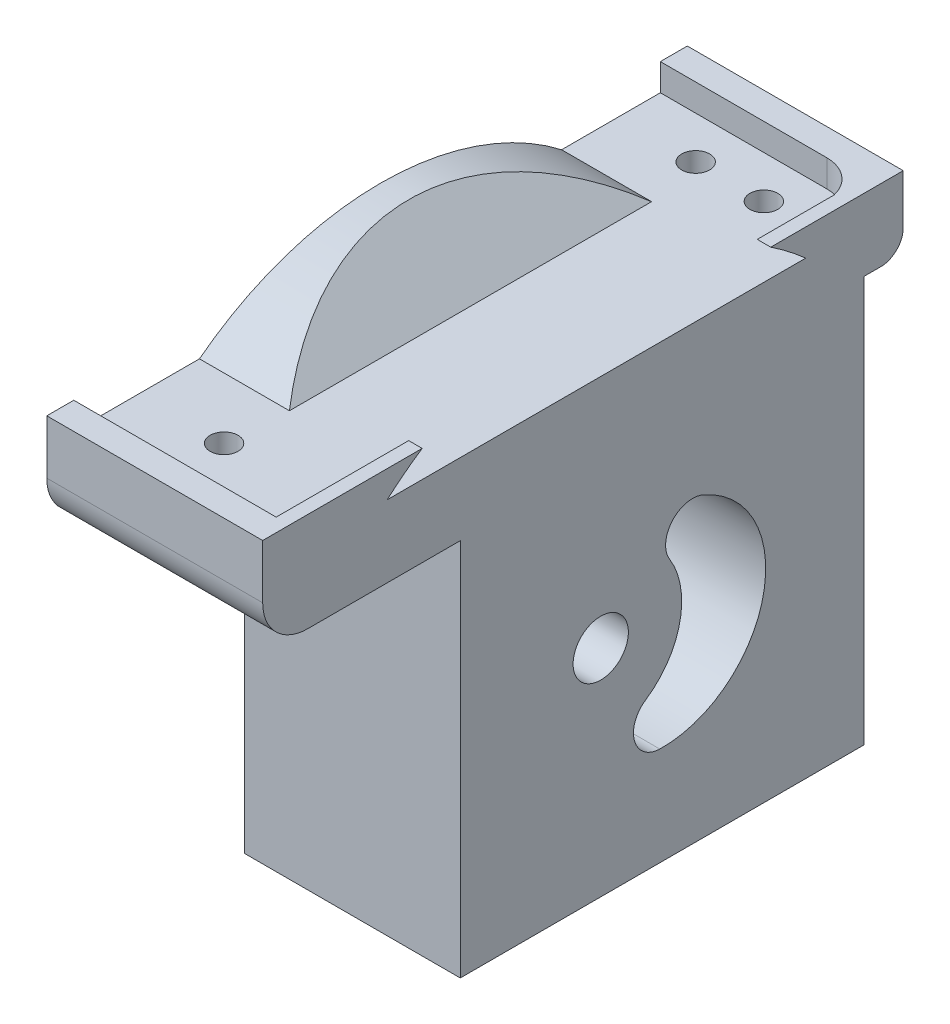
from build123d import *

# Parameters (mm, degrees)
SKETCH1_R           = 3.075
BOSS_EXTRUDE1_DEPTH = 5.5
BOSS_EXTRUDE2_START = -6
SKETCH1_3_R         = 6.11
BOSS_EXTRUDE2_DEPTH = 6
BOSS_EXTRUDE3_START = -17
SKETCH1_4_R         = 18.45
BOSS_EXTRUDE3_DEPTH = 11
BOSS_EXTRUDE4_DEPTH = 10
DRAFT1_ANGLE        = 45
BOSS_EXTRUDE5_DEPTH = 3
SKETCH4_R           = 3.075
BOSS_EXTRUDE6_DEPTH = 1.5
SKETCH3_3_R         = 1.55
CUT_EXTRUDE1_DEPTH  = 11
CUT_EXTRUDE2_START  = -7
SKETCH3_4_R         = 1.55
CUT_EXTRUDE2_DEPTH  = 2.6
CUT_EXTRUDE4_START  = -5.5
SKETCH3_5_R         = 1.55
CUT_EXTRUDE4_DEPTH  = 2.5
CUT_EXTRUDE5_START  = -13
CUT_EXTRUDE5_DEPTH  = 13
FILLET1_R           = 3


with BuildPart() as part:
    # Sketch1 → Boss-Extrude1 (new body)
    with BuildSketch(Plane(origin=(57.798756402, 0, 0), x_dir=(0, 0, -1), z_dir=(1, 0, 0))):
        with BuildLine():
            Line((33.998459558, 75.890266162), (78.898459558, 75.890266162))
            Line((78.898459558, 75.890266162), (78.898459558, 120.990266162))
            Line((78.898459558, 120.990266162), (80.735339486, 120.990266162))
            ThreePointArc((80.735339486, 120.990266162), (82.503106439, 121.722499209), (83.235339486, 123.490266162))
            Line((83.235339486, 123.490266162), (83.235339486, 128.990266162))
            Line((83.235339486, 128.990266162), (80.235339486, 128.990266162))
            Line((80.235339486, 128.990266162), (80.235339486, 125.990266162))
            Line((80.235339486, 125.990266162), (15.035339486, 125.990266162))
            Line((15.035339486, 125.990266162), (15.035339486, 128.990266162))
            Line((15.035339486, 128.990266162), (12.035339486, 128.990266162))
            Line((12.035339486, 128.990266162), (12.035339486, 122.990266162))
            ThreePointArc((12.035339486, 122.990266162), (13.49980558, 119.454732256), (17.035339486, 117.990266162))
            Line((17.035339486, 117.990266162), (33.998459558, 117.990266162))
            Line((33.998459558, 117.990266162), (33.998459558, 75.890266162))
        make_face()
        with Locations((49.610967501, 99.839833556)):
            Circle(SKETCH1_R, mode=Mode.SUBTRACT)
    extrude(amount=BOSS_EXTRUDE1_DEPTH)

    # Sketch1<3> → Boss-Extrude2 (add)
    with BuildSketch(Plane(origin=(57.798756402, 0, 0), x_dir=(0, 0, -1), z_dir=(1, 0, 0)).offset(BOSS_EXTRUDE2_START)):
        with BuildLine():
            Line((33.998459558, 75.890266162), (78.898459558, 75.890266162))
            Line((78.898459558, 75.890266162), (78.898459558, 120.990266162))
            Line((78.898459558, 120.990266162), (80.735339486, 120.990266162))
            ThreePointArc((80.735339486, 120.990266162), (82.503106439, 121.722499209), (83.235339486, 123.490266162))
            Line((83.235339486, 123.490266162), (83.235339486, 128.990266162))
            Line((83.235339486, 128.990266162), (80.235339486, 128.990266162))
            Line((80.235339486, 128.990266162), (80.235339486, 125.990266162))
            Line((80.235339486, 125.990266162), (15.035339486, 125.990266162))
            Line((15.035339486, 125.990266162), (15.035339486, 128.990266162))
            Line((15.035339486, 128.990266162), (12.035339486, 128.990266162))
            Line((12.035339486, 128.990266162), (12.035339486, 122.990266162))
            ThreePointArc((12.035339486, 122.990266162), (13.49980558, 119.454732256), (17.035339486, 117.990266162))
            Line((17.035339486, 117.990266162), (33.998459558, 117.990266162))
            Line((33.998459558, 117.990266162), (33.998459558, 75.890266162))
        make_face()
        with Locations(Location((49.610967501, 99.839833556, 0), (0, 0, 90))):
            Circle(SKETCH1_3_R, mode=Mode.SUBTRACT)
    extrude(amount=BOSS_EXTRUDE2_DEPTH)

    # Sketch1<4> → Boss-Extrude3 (add)
    with BuildSketch(Plane(origin=(57.798756402, 0, 0), x_dir=(0, 0, -1), z_dir=(1, 0, 0)).offset(BOSS_EXTRUDE3_START)):
        with BuildLine():
            Line((33.998459558, 75.890266162), (78.898459558, 75.890266162))
            Line((78.898459558, 75.890266162), (78.898459558, 120.990266162))
            Line((78.898459558, 120.990266162), (80.735339486, 120.990266162))
            ThreePointArc((80.735339486, 120.990266162), (82.503106439, 121.722499209), (83.235339486, 123.490266162))
            Line((83.235339486, 123.490266162), (83.235339486, 128.990266162))
            Line((83.235339486, 128.990266162), (80.235339486, 128.990266162))
            Line((80.235339486, 128.990266162), (80.235339486, 125.990266162))
            Line((80.235339486, 125.990266162), (15.035339486, 125.990266162))
            Line((15.035339486, 125.990266162), (15.035339486, 128.990266162))
            Line((15.035339486, 128.990266162), (12.035339486, 128.990266162))
            Line((12.035339486, 128.990266162), (12.035339486, 122.990266162))
            ThreePointArc((12.035339486, 122.990266162), (13.49980558, 119.454732256), (17.035339486, 117.990266162))
            Line((17.035339486, 117.990266162), (33.998459558, 117.990266162))
            Line((33.998459558, 117.990266162), (33.998459558, 75.890266162))
        make_face()
        with Locations(Location((56.448459558, 98.340266162, 0), (0, 0, 90))):
            Circle(SKETCH1_4_R, mode=Mode.SUBTRACT)
    extrude(amount=BOSS_EXTRUDE3_DEPTH)

    # Sketch2 → Boss-Extrude4 (add)
    with BuildSketch(Plane(origin=(40.798756402, 0, 0), x_dir=(0, 0, -1), z_dir=(1, 0, 0))):
        with BuildLine():
            ThreePointArc((69.263798804, 125.990266162), (49.135339486, 132.839833556), (29.006880169, 125.990266162))
            Line((29.006880169, 125.990266162), (69.263798804, 125.990266162))
        make_face()
    extrude(amount=BOSS_EXTRUDE4_DEPTH)

    # Draft1
    draft1_faces = [part.faces().sort_by_distance(p)[0] for p in [
        (50.798756402, 128.756028079, -49.135339486),
    ]]
    draft(draft1_faces, Plane(origin=(152.119080652, 125.990266162, 0), x_dir=(1, 0, 0), z_dir=(0, 1, 0)), DRAFT1_ANGLE)

    # Sketch3 → Boss-Extrude5 (add)
    with BuildSketch(Plane(origin=(0, 125.990266162, 0), x_dir=(1, 0, 0), z_dir=(0, 1, 0))):
        with BuildLine():
            Line((63.298756402, 80.235339486), (59.298756401, 80.235339486))
            ThreePointArc((59.298756401, 80.235339486), (61.860006097, 79.336901605), (63.298756402, 77.035339486))
            Line((63.298756402, 77.035339486), (63.298756402, 80.235339486))
        make_face()
    extrude(amount=BOSS_EXTRUDE5_DEPTH)

    # Sketch4 → Boss-Extrude6 (add)
    with BuildSketch(Plane(origin=(63.298756402, 0, 0), x_dir=(0, 0, -1), z_dir=(1, 0, 0))):
        with BuildLine():
            Line((29.763910038, 128.990266162), (12.035339486, 128.990266162))
            Line((12.035339486, 128.990266162), (12.035339486, 122.990266162))
            ThreePointArc((12.035339486, 122.990266162), (13.49980558, 119.454732256), (17.035339486, 117.990266162))
            Line((17.035339486, 117.990266162), (33.998459558, 117.990266162))
            Line((33.998459558, 117.990266162), (33.998459558, 75.890266162))
            Line((33.998459558, 75.890266162), (78.898459558, 75.890266162))
            Line((78.898459558, 75.890266162), (78.898459558, 120.990266162))
            Line((78.898459558, 120.990266162), (80.735339486, 120.990266162))
            ThreePointArc((80.735339486, 120.990266162), (82.503106439, 121.722499209), (83.235339486, 123.490266162))
            Line((83.235339486, 123.490266162), (83.235339486, 128.990266162))
            Line((83.235339486, 128.990266162), (68.506768934, 128.990266162))
            ThreePointArc((68.506768934, 128.990266162), (70.505131495, 127.558635649), (72.398075234, 125.990266162))
            Line((72.398075234, 125.990266162), (25.872603738, 125.990266162))
            ThreePointArc((25.872603738, 125.990266162), (27.765547478, 127.558635649), (29.763910038, 128.990266162))
        make_face()
        with Locations((49.610967501, 99.839833556)):
            Circle(SKETCH4_R, mode=Mode.SUBTRACT)
    extrude(amount=BOSS_EXTRUDE6_DEPTH)

    # Sketch3<3> → Cut-Extrude1 (cut)
    with BuildSketch(Plane(origin=(0, 125.990266162, 0), x_dir=(1, 0, 0), z_dir=(0, 1, 0))):
        with Locations(Location((49.426066799, 75.535339486, 0), (0, 0, 270))):
            Circle(SKETCH3_3_R)
        with Locations(Location((57.007859867, 75.535339486, 0), (0, 0, 270))):
            Circle(SKETCH3_3_R)
        with Locations(Location((50.298756402, 22.24178562, 0), (0, 0, 180))):
            Circle(SKETCH3_3_R)
    extrude(amount=-CUT_EXTRUDE1_DEPTH, mode=Mode.SUBTRACT)

    # Sketch3<4> → Cut-Extrude2 (cut)
    # profile 1 of 4: a face of its own
    with BuildSketch(Plane(origin=(0, 125.990266162, 0), x_dir=(1, 0, 0), z_dir=(0, 1, 0)).offset(CUT_EXTRUDE2_START)):
        Polygon((54.157859867, 77.180787753), (54.157859867, 73.889891219), (57.007859867, 72.244442952), (59.857859867, 73.889891219), (59.857859867, 77.180787753), (57.007859867, 78.826236021), align=None)
        with Locations(Location((57.007859867, 75.535339486, 0), (0, 0, 270))):
            Circle(SKETCH3_4_R, mode=Mode.SUBTRACT)
    # profile 2 of 4: a face of its own
    with BuildSketch(Plane(origin=(0, 125.990266162, 0), x_dir=(1, 0, 0), z_dir=(0, 1, 0)).offset(CUT_EXTRUDE2_START)):
        Polygon((46.576066799, 77.180787753), (46.576066799, 73.889891219), (49.426066799, 72.244442952), (52.276066799, 73.889891219), (52.276066799, 77.180787753), (49.426066799, 78.826236021), align=None)
        with Locations(Location((49.426066799, 75.535339486, 0), (0, 0, 270))):
            Circle(SKETCH3_4_R, mode=Mode.SUBTRACT)
    # profile 3 of 4: a face of its own
    with BuildSketch(Plane(origin=(0, 125.990266162, 0), x_dir=(1, 0, 0), z_dir=(0, 1, 0)).offset(CUT_EXTRUDE2_START)):
        Polygon((59.857859867, 78.898459558), (59.857859867, 77.180787753), (57.007859867, 78.826236021), (54.157859867, 77.180787753), (54.157859867, 78.898459558), align=None)
    # profile 4 of 4: a face of its own
    with BuildSketch(Plane(origin=(0, 125.990266162, 0), x_dir=(1, 0, 0), z_dir=(0, 1, 0)).offset(CUT_EXTRUDE2_START)):
        Polygon((52.276066799, 78.898459558), (52.276066799, 77.180787753), (49.426066799, 78.826236021), (46.576066799, 77.180787753), (46.576066799, 78.898459558), align=None)
    extrude(amount=-CUT_EXTRUDE2_DEPTH, mode=Mode.SUBTRACT)

    # Sketch3<5> → Cut-Extrude4 (cut)
    with BuildSketch(Plane(origin=(0, 125.990266162, 0), x_dir=(1, 0, 0), z_dir=(0, 1, 0)).offset(CUT_EXTRUDE4_START)):
        Polygon((48.653308134, 19.39178562), (51.944204669, 19.39178562), (53.589652936, 22.24178562), (51.944204669, 25.09178562), (48.653308134, 25.09178562), (47.007859867, 22.24178562), align=None)
        with Locations(Location((50.298756402, 22.24178562, 0), (0, 0, 180))):
            Circle(SKETCH3_5_R, mode=Mode.SUBTRACT)
    extrude(amount=-CUT_EXTRUDE4_DEPTH, mode=Mode.SUBTRACT)

    # Sketch6 → Cut-Extrude5 (cut)
    with BuildSketch(Plane.ZY.offset(-51.798756402).offset(CUT_EXTRUDE5_START)):
        with BuildLine():
            ThreePointArc((-47.52627647, 91.08460293), (-58.402028717, 97.911818335), (-51.38169206, 108.663921867))
            ThreePointArc((-51.38169206, 108.663921867), (-67.681482224, 95.876691159), (-47.52627647, 91.08460293))
        make_face()
    extrude(amount=CUT_EXTRUDE5_DEPTH, mode=Mode.SUBTRACT)

    # Fillet1
    fillet1_edges = [part.edges().sort_by_distance(p)[0] for p in [
        (58.298756402, 91.08460293, -47.52627647),
        (58.298756402, 108.663921867, -51.38169206),
    ]]
    fillet(fillet1_edges, radius=FILLET1_R)


solid = part.part
